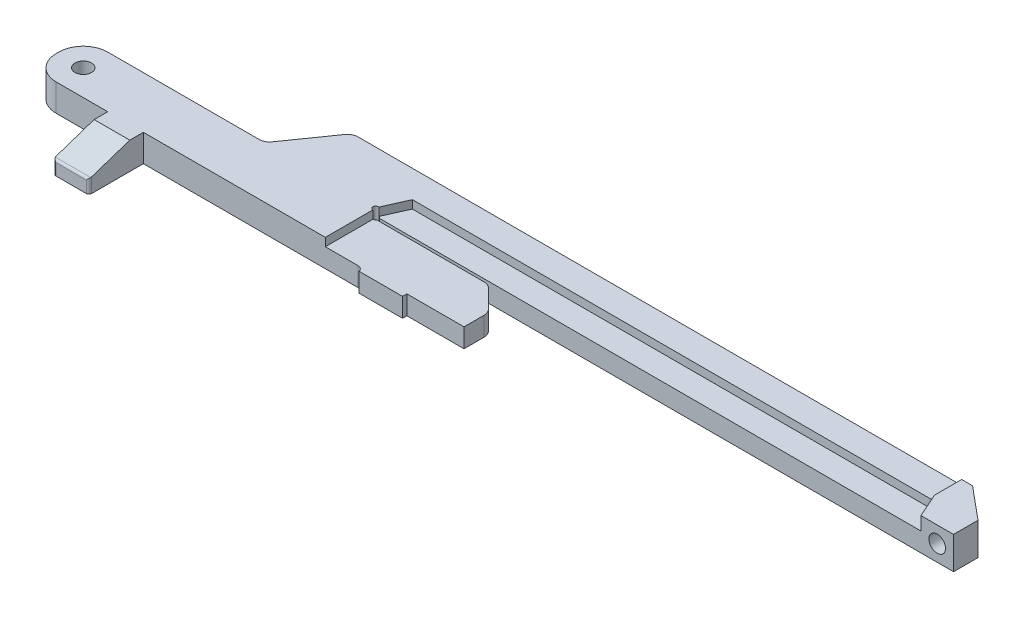
from build123d import *

# Parameters (mm, degrees)
SKETCH_1_R          = 1.525
EXTRUDE_2_DEPTH     = 5
CUT_EXTRUDE_START   = 3.5
CUT_EXTRUDE_1_DEPTH = 158.761433703
EXTRUDE_START       = -5
EXTRUDE_4_DEPTH     = 5.95
SKETCH_4_R          = 1.525
CUT_EXTRUDE_2_DEPTH = 162.293684005
SKETCH_5_R          = 3
CUT_EXTRUDE_3_DEPTH = 2
FILLET_1_R          = 4.5
CUT_EXTRUDE_4_DEPTH = 162.293684005
FILLET_4_R          = 0.5
FILLET_5_R          = 2
FILLET_11_R         = 1
CUT_EXTRUDE_5_DEPTH = 10
FILLET_12_R         = 2


with BuildPart() as part:
    # 草图1 → 凸台-拉伸2 (new body)
    with BuildSketch(Plane(origin=(0, 0, 0), x_dir=(1, 0, 0), z_dir=(0, 1, 0))):
        with BuildLine():
            Line((0, 0), (33.333333333, 0))
            Line((33.333333333, 0), (40, 9.5))
            Line((40, 9.5), (44, 9.5))
            Line((44, 9.5), (54, 9.5))
            Line((54, 9.5), (154, 9.5))
            Line((154, 9.5), (160, 4.5))
            Line((160, 4.5), (160, 0))
            Line((160, 0), (54.433012702, 0))
            ThreePointArc((54.433012702, 0), (53.5, -0.25), (54.433012702, -0.5))
            Line((54.433012702, -0.5), (67, -0.5))
            Line((67, -0.5), (70, -0.5))
            Line((70, -0.5), (79.5, -0.5))
            Line((79.5, -0.5), (79.5, -9.5))
            Line((79.5, -9.5), (70, -9.5))
            Line((70, -9.5), (69, -9.5))
            Line((69, -9.5), (69, -10.3))
            Line((69, -10.3), (61, -10.3))
            Line((61, -10.3), (61, -9.5))
            Line((61, -9.5), (20.55, -9.5))
            Line((20.55, -9.5), (20.55, -19.5))
            Line((20.55, -19.5), (14, -19.5))
            Line((14, -19.5), (14, -9.5))
            Line((14, -9.5), (0, -9.5))
            Line((0, -9.5), (0, 0))
        make_face()
        with Locations(Location((4.75, -4.75, 0), (0, 0, 270))):
            Circle(SKETCH_1_R, mode=Mode.SUBTRACT)
    extrude(amount=EXTRUDE_2_DEPTH)

    # 草图2 → 切除-拉伸1 (cut, through all)
    with BuildSketch(Plane(origin=(0, 0, 0), x_dir=(1, 0, 0), z_dir=(0, 1, 0)).offset(CUT_EXTRUDE_START)):
        Polygon((54, -9.5), (54, -0.5), (67, -0.5), (83.595743226, -0.5), (83.595743226, -15.95528926), (54, -15.95528926), align=None)
        Polygon((54, 0), (154, 0), (152, 4.5), (56, 4.5), align=None)
    extrude(amount=CUT_EXTRUDE_1_DEPTH, mode=Mode.SUBTRACT)

    # 草图3 → 凸台-拉伸4 (add)
    with BuildSketch(Plane(origin=(0, 5, 0), x_dir=(1, 0, 0), z_dir=(0, 1, 0)).offset(EXTRUDE_START)):
        Polygon((152, 4.5), (152, 9.5), (154, 9.5), (160, 4.5), (160, 0), (154, 0), align=None)
    extrude(amount=EXTRUDE_4_DEPTH)

    # 草图4 → 切除-拉伸2 (cut, through all)
    with BuildSketch(Plane.XY):
        with Locations((157, 2.975)):
            Circle(SKETCH_4_R)
    extrude(amount=-CUT_EXTRUDE_2_DEPTH, mode=Mode.SUBTRACT)

    # 草图5 → 切除-拉伸3 (cut)
    with BuildSketch(Plane(origin=(0, 0, 0), x_dir=(1, 0, 0), z_dir=(0, 1, 0))):
        with Locations(Location((4.75, -4.75, 0), (0, 0, 270))):
            Circle(SKETCH_5_R)
    extrude(amount=CUT_EXTRUDE_3_DEPTH, mode=Mode.SUBTRACT)

    # 圆角1
    fillet_1_edges = [part.edges().sort_by_distance(p)[0] for p in [
        (0, 2.5, 9.5),
        (0, 2.5, 0),
    ]]
    fillet(fillet_1_edges, radius=FILLET_1_R)

    # 草图7 → 切除-拉伸4 (cut, through all)
    with BuildSketch(Plane(origin=(0, 0, 0), x_dir=(0, 0, -1), z_dir=(1, 0, 0))):
        Polygon((-19.5, 2.5), (-12, 5), (-19.5, 5), align=None)
    extrude(amount=CUT_EXTRUDE_4_DEPTH, mode=Mode.SUBTRACT)

    # 圆角4
    fillet_4_edges = [part.edges().sort_by_distance(p)[0] for p in [
        (20.55, 1.25, 19.5),
        (14, 1.25, 19.5),
        (17.275, 2.5, 19.5),
    ]]
    fillet(fillet_4_edges, radius=FILLET_4_R)

    # 圆角5
    fillet_5_edges = [part.edges().sort_by_distance(p)[0] for p in [
        (33.333333333, 2.5, 0),
        (40, 2.5, -9.5),
    ]]
    fillet(fillet_5_edges, radius=FILLET_5_R)

    # 圆角11
    # the kernel refuses this fillet: 1 mm, written as the material it adds along each edge
    with BuildSketch(Plane(origin=(61, 0, 9.5), x_dir=(-1, 0, 0), z_dir=(0, 1, 0))) as fillet_11_piece_1:
        with BuildLine():
            CenterArc((0.979795897, 1), FILLET_11_R, 191.536959033, 78.463040967)
            Line((0, 0.8), (-0.019595918, 0.796))
            ThreePointArc((-0.019595918, 0.796), (-0.02, 0.4), (-0.02, 0))
            Line((-0.02, 0), (0, -0.02))
            Line((0, -0.02), (0.979795897, -0.02))
            Line((0.979795897, -0.02), (0.979795897, 0))
        make_face()
    extrude(amount=3.5)

    # 草图9 → 切除-拉伸5 (cut)
    with BuildSketch(Plane(origin=(0, 0, 0), x_dir=(1, 0, 0), z_dir=(0, 1, 0))):
        Polygon((75, -0.5), (79.5, -5), (79.5, -0.5), align=None)
    extrude(amount=CUT_EXTRUDE_5_DEPTH, mode=Mode.SUBTRACT)

    # 圆角12
    fillet_12_edges = [part.edges().sort_by_distance(p)[0] for p in [
        (75, 1.75, 0.5),
        (79.5, 1.75, 5),
    ]]
    fillet(fillet_12_edges, radius=FILLET_12_R)


solid = part.part
